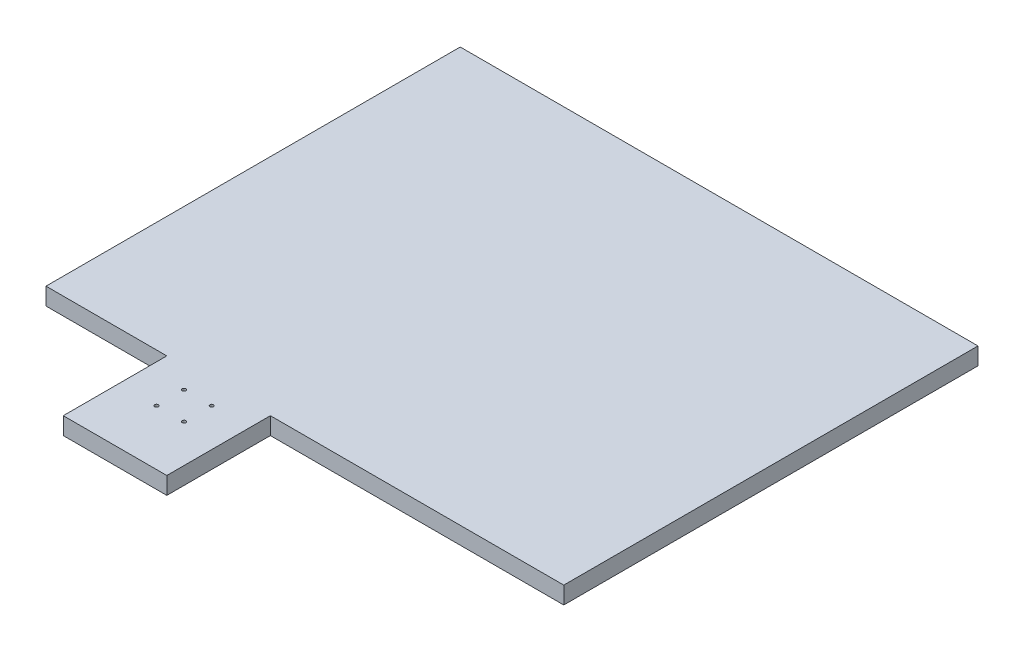
from build123d import *

# Parameters (mm, degrees)
EXTRUDE_1_DEPTH     = 10
SKETCH_2_W          = 20
SKETCH_2_H          = 20
SKETCH_2_R          = 1.05
CUT_EXTRUDE_2_DEPTH = 8
SKETCH_2_3_R        = 1.05
CUT_EXTRUDE_3_DEPTH = 235.520787991


with BuildPart() as part:
    # 草圖1 → 填料-伸長1 (new body)
    with BuildSketch(Plane(origin=(0, 0, 0), x_dir=(1, 0, 0), z_dir=(0, 1, 0))):
        Polygon((-150, -120), (-80, -120), (-80, -180), (-20, -180), (-20, -120), (150, -120), (150, 120), (-150, 120), align=None)
    extrude(amount=EXTRUDE_1_DEPTH)

    # 草圖2 → 除料-伸長2 (cut)
    with BuildSketch(Plane.XZ):
        with Locations((-50, 140)):
            Rectangle(SKETCH_2_W, SKETCH_2_H)
        with Locations((-58, 132)):
            Circle(SKETCH_2_R, mode=Mode.SUBTRACT)
        with Locations((-42, 132)):
            Circle(SKETCH_2_R, mode=Mode.SUBTRACT)
        with Locations((-58, 148)):
            Circle(SKETCH_2_R, mode=Mode.SUBTRACT)
        with Locations((-42, 148)):
            Circle(SKETCH_2_R, mode=Mode.SUBTRACT)
    extrude(amount=-CUT_EXTRUDE_2_DEPTH, mode=Mode.SUBTRACT)

    # 草圖2<3> → 除料-伸長3 (cut, through all)
    with BuildSketch(Plane.XZ):
        with Locations((-58, 132)):
            Circle(SKETCH_2_3_R)
        with Locations((-58, 148)):
            Circle(SKETCH_2_3_R)
        with Locations((-42, 148)):
            Circle(SKETCH_2_3_R)
        with Locations((-42, 132)):
            Circle(SKETCH_2_3_R)
    extrude(amount=-CUT_EXTRUDE_3_DEPTH, mode=Mode.SUBTRACT)


solid = part.part
